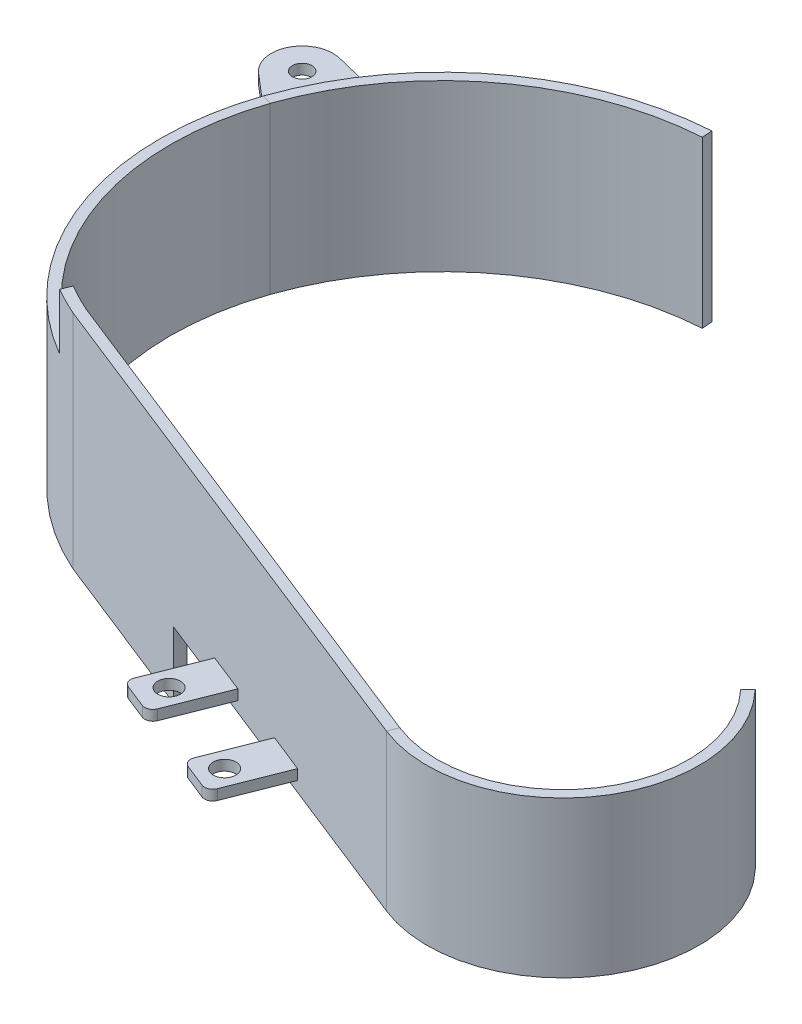
from build123d import *

# Parameters (mm, degrees)
BASE_FLANGE2_DEPTH  = 63.5
SKETCH8_W           = 331.965977541
SKETCH8_H           = 30.9372
CUT_EXTRUDE1_DEPTH  = 256.834789278
SKETCH9_W           = 150.054784792
SKETCH9_H           = 34.679027416
CUT_EXTRUDE2_DEPTH  = 256.834789278
BOSS_EXTRUDE1_DEPTH = 20.32
SKETCH12_W          = 12.7
SKETCH12_H          = 3.175
BOSS_EXTRUDE2_DEPTH = 21.59
SKETCH13_R          = 3.5
CUT_EXTRUDE5_DEPTH  = 21.59
FILLET1_R           = 2.54
SKETCH14_R          = 3
BOSS_EXTRUDE3_DEPTH = 3.175


# Sheet-metal steps are written as plain solids
with BuildPart() as part:
    # Sketch1 → Base-Flange2 (new body)
    with BuildSketch(Plane(origin=(0, 0, 0), x_dir=(1, 0, 0), z_dir=(0, 1, 0))):
        with BuildLine():
            Line((80.769724328, -109.524319493), (-79.196155859, -46.179527064))
            ThreePointArc((-79.196155859, -46.179527064), (-120.807882744, -4.431069312), (-123.261655777, 54.4624663))
            ThreePointArc((-123.261655777, 54.4624663), (-94.143629301, 94.693559024), (-47.619751411, 112.069665426))
            Line((-47.619751411, 112.069665426), (-47.822872467, 115.238161415))
            ThreePointArc((-47.822872467, 115.238161415), (-96.069602275, 97.217694761), (-126.264058949, 55.495051727))
            ThreePointArc((-126.264058949, 55.495051727), (-123.704959468, -5.730431564), (-80.422032808, -49.108963745))
            Line((-80.422032808, -49.108963745), (79.600772216, -112.476297806))
            ThreePointArc((79.600772216, -112.476297806), (129.785334621, -96.938999369), (125.376413714, -44.589602401))
            Line((125.376413714, -44.589602401), (123.077927873, -46.779942064))
            ThreePointArc((123.077927873, -46.779942064), (127.152879464, -95.163948708), (80.769724328, -109.524319493))
        make_face()
    extrude(amount=-BASE_FLANGE2_DEPTH)

    # Sketch8 → Cut-Extrude1 (cut, through all)
    with BuildSketch(Plane(origin=(-27.711967852, 0, 69.98159058), x_dir=(0.9297569489485495, 0, 0.36817389353657926), z_dir=(-0.36817389353657926, 0, 0.9297569489485495))):
        with Locations((13.838804259, 0)):
            Rectangle(SKETCH8_W, SKETCH8_H)
    extrude(amount=-CUT_EXTRUDE1_DEPTH, mode=Mode.SUBTRACT)

    # Sketch9 → Cut-Extrude2 (cut, through all)
    with BuildSketch(Plane(origin=(-27.711967852, 0, 69.98159058), x_dir=(0.9297569489485495, 0, 0.36817389353657926), z_dir=(-0.36817389353657926, 0, 0.9297569489485495))):
        with Locations((-140.963680017, -15.4686)):
            Rectangle(SKETCH9_W, SKETCH9_H)
    extrude(amount=-CUT_EXTRUDE2_DEPTH, mode=Mode.SUBTRACT)

    # Sketch11 → Boss-Extrude1 (add)
    with BuildSketch(Plane.XZ.offset(63.5)):
        with BuildLine():
            Line((-47.619751411, -112.069665426), (-47.822872467, -115.238161415))
            ThreePointArc((-47.822872467, -115.238161415), (-96.069602275, -97.217694761), (-126.264058949, -55.495051727))
            ThreePointArc((-126.264058949, -55.495051727), (-123.704959468, 5.730431564), (-80.422032808, 49.108963745))
            Line((-80.422032808, 49.108963745), (-29.009735812, 69.467688228))
            Line((-29.009735812, 69.467688228), (-27.8407837, 66.515709916))
            Line((-27.8407837, 66.515709916), (-79.196155859, 46.179527064))
            ThreePointArc((-79.196155859, 46.179527064), (-120.807882744, 4.431069312), (-123.261655777, -54.4624663))
            ThreePointArc((-123.261655777, -54.4624663), (-94.143629301, -94.693559024), (-47.619751411, -112.069665426))
        make_face()
    extrude(amount=BOSS_EXTRUDE1_DEPTH)

    # Sketch12 → Boss-Extrude2 (add)
    with BuildSketch(Plane(origin=(-27.711967852, 0, 69.98159058), x_dir=(0.9297569489485495, 0, 0.3681738935365793), z_dir=(-0.36817389353657937, 0, 0.9297569489485495))):
        with Locations((27.459636868, -58.7121)):
            Rectangle(SKETCH12_W, SKETCH12_H)
        with Locations((60.299587615, -58.7121)):
            Rectangle(SKETCH12_W, SKETCH12_H)
    extrude(amount=BOSS_EXTRUDE2_DEPTH)

    # Sketch13 → Cut-Extrude5 (cut)
    with BuildSketch(Plane(origin=(0, -57.1246, 0), x_dir=(1, 0, 0), z_dir=(0, 1, 0))):
        with Locations(Location((22.976705445, -105.756645834, 0), (0, 0, 270))):
            Circle(SKETCH13_R)
        with Locations(Location((-7.181091285, -92.717889538, 0), (0, 0, 270))):
            Circle(SKETCH13_R)
    extrude(amount=-CUT_EXTRUDE5_DEPTH, mode=Mode.SUBTRACT)

    # Fillet1
    fillet1_edges = [part.edges().sort_by_distance(p)[0] for p in [
        (-4.226097394, -58.7121, 102.502868753),
        (-16.034010646, -58.7121, 97.827060305),
        (26.307075016, -58.7121, 114.593681283),
        (14.499161765, -58.7121, 109.917872835),
    ]]
    fillet(fillet1_edges, radius=FILLET1_R)

    # Sketch14 → Boss-Extrude3 (add)
    with BuildSketch(Plane(origin=(0, -36.672703388, 0), x_dir=(1, 0, 0), z_dir=(0, 1, 0))):
        with BuildLine():
            Line((-136.967303974, 64.658320793), (-126.264058949, 55.495051727))
            ThreePointArc((-126.264058949, 55.495051727), (-121.330527713, 67.047255445), (-114.82018179, 77.790091998))
            Line((-114.82018179, 77.790091998), (-128.504840161, 81.144951055))
            ThreePointArc((-128.504840161, 81.144951055), (-139.246667683, 76.243475882), (-136.967303974, 64.658320793))
        make_face()
        with Locations(Location((-130.77278095, 71.8938933, 0), (0, 0, 270))):
            Circle(SKETCH14_R, mode=Mode.SUBTRACT)
    extrude(amount=-BOSS_EXTRUDE3_DEPTH)


solid = part.part
